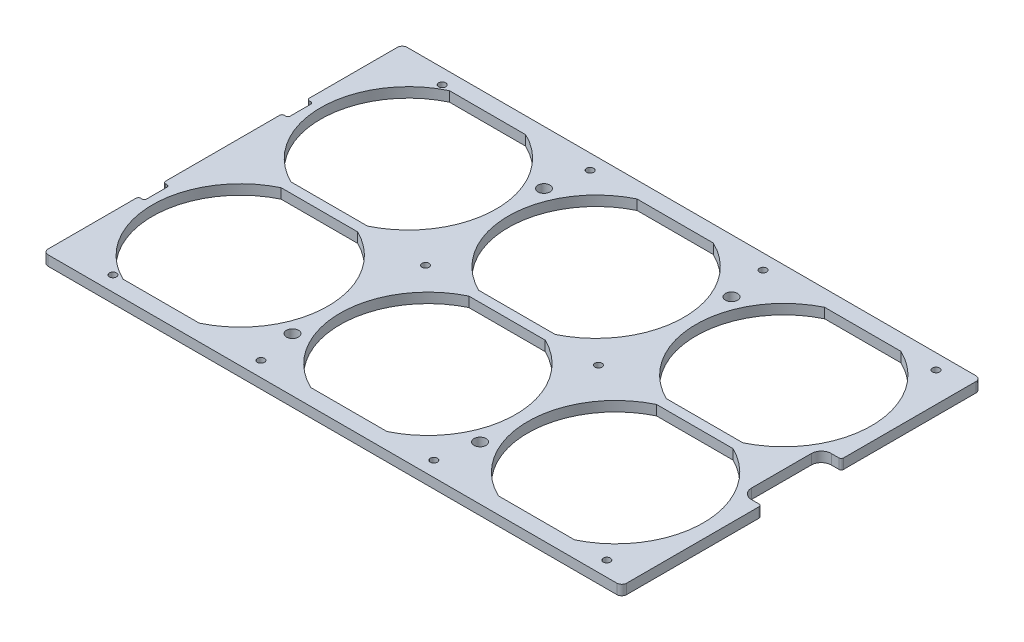
from build123d import *

# Parameters (mm, degrees)
SKETCH1_R               = 2.2479
SKETCH1_R_2             = 3.81
BOSS_EXTRUDE1_DEPTH     = 6.35
CUT_EXTRUDE1_DEPTH      = 217.831812703
CUT_EXTRUDE1_DEPTH_BACK = 217.831812703
SKETCH3_W               = 3.81
SKETCH3_H               = 15.875
CUT_EXTRUDE2_DEPTH      = 217.831812703
FILLET1_R               = 1.524


with BuildPart() as part:
    # Sketch1 → Boss-Extrude1 (new body)
    with BuildSketch(Plane(origin=(0, 0, 0), x_dir=(1, 0, 0), z_dir=(0, 1, 0))):
        with BuildLine():
            Line((-180.975, 114.3), (180.975, 114.3))
            ThreePointArc((180.975, 114.3), (183.22006403, 113.37006403), (184.15, 111.125))
            Line((184.15, 111.125), (184.15, -111.125))
            ThreePointArc((184.15, -111.125), (183.22006403, -113.37006403), (180.975, -114.3))
            Line((180.975, -114.3), (-180.975, -114.3))
            ThreePointArc((-180.975, -114.3), (-183.22006403, -113.37006403), (-184.15, -111.125))
            Line((-184.15, -111.125), (-184.15, 111.125))
            ThreePointArc((-184.15, 111.125), (-183.22006403, 113.37006403), (-180.975, 114.3))
        make_face()
        with Locations((-149.225, -104.775)):
            Circle(SKETCH1_R, mode=Mode.SUBTRACT)
        with Locations((-55.033333333, -104.775)):
            Circle(SKETCH1_R, mode=Mode.SUBTRACT)
        with Locations((55.033333333, -104.775)):
            Circle(SKETCH1_R, mode=Mode.SUBTRACT)
        with Locations((165.1, -104.775)):
            Circle(SKETCH1_R, mode=Mode.SUBTRACT)
        with Locations((165.1, 104.775)):
            Circle(SKETCH1_R, mode=Mode.SUBTRACT)
        with Locations((55.033333333, 104.775)):
            Circle(SKETCH1_R, mode=Mode.SUBTRACT)
        with Locations((-55.033333333, 104.775)):
            Circle(SKETCH1_R, mode=Mode.SUBTRACT)
        with Locations((-149.225, 104.775)):
            Circle(SKETCH1_R, mode=Mode.SUBTRACT)
        with Locations((-55.033333333, 0)):
            Circle(SKETCH1_R, mode=Mode.SUBTRACT)
        with Locations((55.033333333, 0)):
            Circle(SKETCH1_R, mode=Mode.SUBTRACT)
        with Locations((-59.69, 80.01)):
            Circle(SKETCH1_R_2, mode=Mode.SUBTRACT)
        with Locations((-59.69, -80.01)):
            Circle(SKETCH1_R_2, mode=Mode.SUBTRACT)
        with Locations((59.69, -80.01)):
            Circle(SKETCH1_R_2, mode=Mode.SUBTRACT)
        with Locations((59.69, 80.01)):
            Circle(SKETCH1_R_2, mode=Mode.SUBTRACT)
        with BuildLine():
            Line((-24.3078, -3.1623), (24.3078, -3.1623))
            ThreePointArc((24.3078, -3.1623), (55.879209158, -53.5178), (24.3078, -103.8733))
            Line((24.3078, -103.8733), (-24.3078, -103.8733))
            ThreePointArc((-24.3078, -103.8733), (-55.879209158, -53.5178), (-24.3078, -3.1623))
        make_face(mode=Mode.SUBTRACT)
        with BuildLine():
            Line((95.136490842, -3.1623), (143.752090842, -3.1623))
            ThreePointArc((143.752090842, -3.1623), (175.3235, -53.5178), (143.752090842, -103.8733))
            Line((143.752090842, -103.8733), (95.136490842, -103.8733))
            ThreePointArc((95.136490842, -103.8733), (63.565081684, -53.5178), (95.136490842, -3.1623))
        make_face(mode=Mode.SUBTRACT)
        with BuildLine():
            Line((-143.752090842, -3.1623), (-95.136490842, -3.1623))
            ThreePointArc((-95.136490842, -3.1623), (-63.565081684, -53.5178), (-95.136490842, -103.8733))
            Line((-95.136490842, -103.8733), (-143.752090842, -103.8733))
            ThreePointArc((-143.752090842, -103.8733), (-175.3235, -53.5178), (-143.752090842, -3.1623))
        make_face(mode=Mode.SUBTRACT)
        with BuildLine():
            Line((-24.3078, 103.8733), (24.3078, 103.8733))
            ThreePointArc((24.3078, 103.8733), (55.879209158, 53.5178), (24.3078, 3.1623))
            Line((24.3078, 3.1623), (-24.3078, 3.1623))
            ThreePointArc((-24.3078, 3.1623), (-55.879209158, 53.5178), (-24.3078, 103.8733))
        make_face(mode=Mode.SUBTRACT)
        with BuildLine():
            Line((-143.752090842, 103.8733), (-95.136490842, 103.8733))
            ThreePointArc((-95.136490842, 103.8733), (-63.565081684, 53.5178), (-95.136490842, 3.1623))
            Line((-95.136490842, 3.1623), (-143.752090842, 3.1623))
            ThreePointArc((-143.752090842, 3.1623), (-175.3235, 53.5178), (-143.752090842, 103.8733))
        make_face(mode=Mode.SUBTRACT)
        with BuildLine():
            Line((95.136490842, 103.8733), (143.752090842, 103.8733))
            ThreePointArc((143.752090842, 103.8733), (175.3235, 53.5178), (143.752090842, 3.1623))
            Line((143.752090842, 3.1623), (95.136490842, 3.1623))
            ThreePointArc((95.136490842, 3.1623), (63.565081684, 53.5178), (95.136490842, 103.8733))
        make_face(mode=Mode.SUBTRACT)
    extrude(amount=BOSS_EXTRUDE1_DEPTH)

    # Sketch2 → Cut-Extrude1 (cut, two sides: drawn at the far end of the back side and taken through both)
    with BuildSketch(Plane(origin=(0, 6.35, 0), x_dir=(1, 0, 0), z_dir=(0, 1, 0)).offset(-CUT_EXTRUDE1_DEPTH_BACK)):
        with BuildLine():
            Line((184.15, 25.4), (177.8, 25.4))
            ThreePointArc((177.8, 25.4), (173.309871939, 23.540128061), (171.45, 19.05))
            Line((171.45, 19.05), (171.45, -19.05))
            ThreePointArc((171.45, -19.05), (173.309871939, -23.540128061), (177.8, -25.4))
            Line((177.8, -25.4), (184.15, -25.4))
            Line((184.15, -25.4), (184.15, 25.4))
        make_face()
    extrude(amount=CUT_EXTRUDE1_DEPTH + CUT_EXTRUDE1_DEPTH_BACK, mode=Mode.SUBTRACT)

    # Sketch3 → Cut-Extrude2 (cut, through all)
    with BuildSketch(Plane(origin=(0, 6.35, 0), x_dir=(1, 0, 0), z_dir=(0, 1, 0))):
        with Locations((-182.245, 45.72)):
            Rectangle(SKETCH3_W, SKETCH3_H)
        with Locations((-182.245, -45.72)):
            Rectangle(SKETCH3_W, SKETCH3_H)
    extrude(amount=-CUT_EXTRUDE2_DEPTH, mode=Mode.SUBTRACT)

    # Fillet1
    fillet1_edges = [part.edges().sort_by_distance(p)[0] for p in [
        (184.15, 3.175, 25.4),
        (184.15, 3.175, -25.4),
        (-180.34, 3.175, 37.7825),
        (-184.15, 3.175, 37.7825),
        (-184.15, 3.175, 53.6575),
        (-180.34, 3.175, 53.6575),
        (-184.15, 3.175, -37.7825),
        (-180.34, 3.175, -37.7825),
        (-184.15, 3.175, -53.6575),
        (-180.34, 3.175, -53.6575),
    ]]
    fillet(fillet1_edges, radius=FILLET1_R)


solid = part.part
